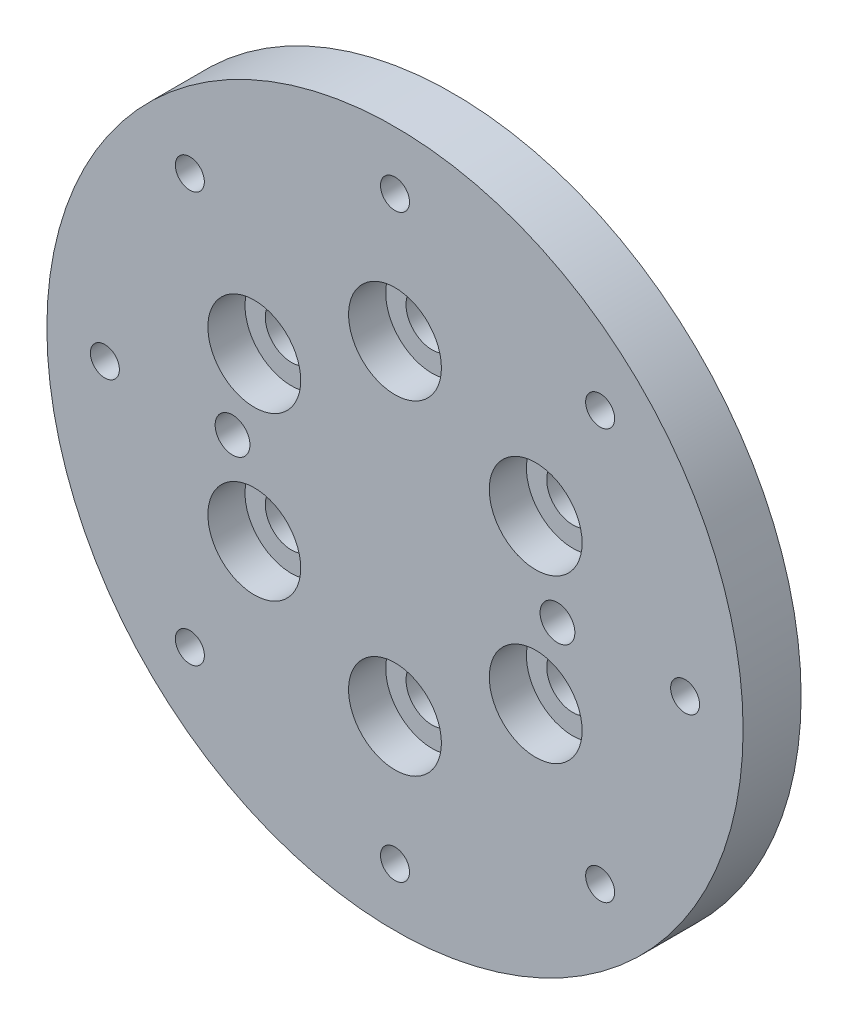
from build123d import *

# Parameters (mm, degrees)
SKETCH1_R                                            = 30
BOSS_EXTRUDE1_DEPTH                                  = 5
CBORE_FOR_M4_HEX_SOCKET_THIN_HEAD_CAP_SC_D           = 4.5
CBORE_FOR_M4_HEX_SOCKET_THIN_HEAD_CAP_SC_CBORE_D     = 8
CBORE_FOR_M4_HEX_SOCKET_THIN_HEAD_CAP_SC_CBORE_DEPTH = 3.2
F_3_0MM_DOWEL_HOLE1_OUTLINE_R                        = 1.5
F_3_0MM_DOWEL_HOLE1_DEPTH                            = 5
TAP_DRILL_FOR_M3_TAP1_D                              = 2.5


# Read off the part's stored shape, not the designer's step: Ø3.0mm Dowel Hole1
with BuildPart() as part:
    # Sketch1 → Boss-Extrude1 (new body)
    with BuildSketch(Plane.XY):
        Circle(SKETCH1_R)
    extrude(amount=BOSS_EXTRUDE1_DEPTH)

    # CBORE for M4 Hex Socket Thin Head Cap Screw1 (through all)
    with Locations(Plane.XY.offset(5)):
        with Locations((-12.124355653, 7), (0, 14), (12.124355653, 7), (12.124355653, -7), (0, -14), (-12.124355653, -7)):
            CounterBoreHole(CBORE_FOR_M4_HEX_SOCKET_THIN_HEAD_CAP_SC_D / 2, CBORE_FOR_M4_HEX_SOCKET_THIN_HEAD_CAP_SC_CBORE_D / 2, CBORE_FOR_M4_HEX_SOCKET_THIN_HEAD_CAP_SC_CBORE_DEPTH)

    # Ø3.0mm Dowel Hole1 outline → Ø3.0mm Dowel Hole1 (cut)
    with BuildSketch(Plane.XY):
        with Locations((14, 0)):
            Circle(F_3_0MM_DOWEL_HOLE1_OUTLINE_R)
        with Locations((-14, 0)):
            Circle(F_3_0MM_DOWEL_HOLE1_OUTLINE_R)
    extrude(amount=F_3_0MM_DOWEL_HOLE1_DEPTH, mode=Mode.SUBTRACT)

    # Tap Drill for M3 Tap1 (through all)
    with Locations(Plane.XY.offset(5)):
        with Locations((-17.67766953, 17.67766953), (0, 25), (17.67766953, 17.67766953), (25, 0), (17.67766953, -17.67766953), (0, -25), (-17.67766953, -17.67766953), (-25, 0)):
            Hole(TAP_DRILL_FOR_M3_TAP1_D / 2)


solid = part.part
